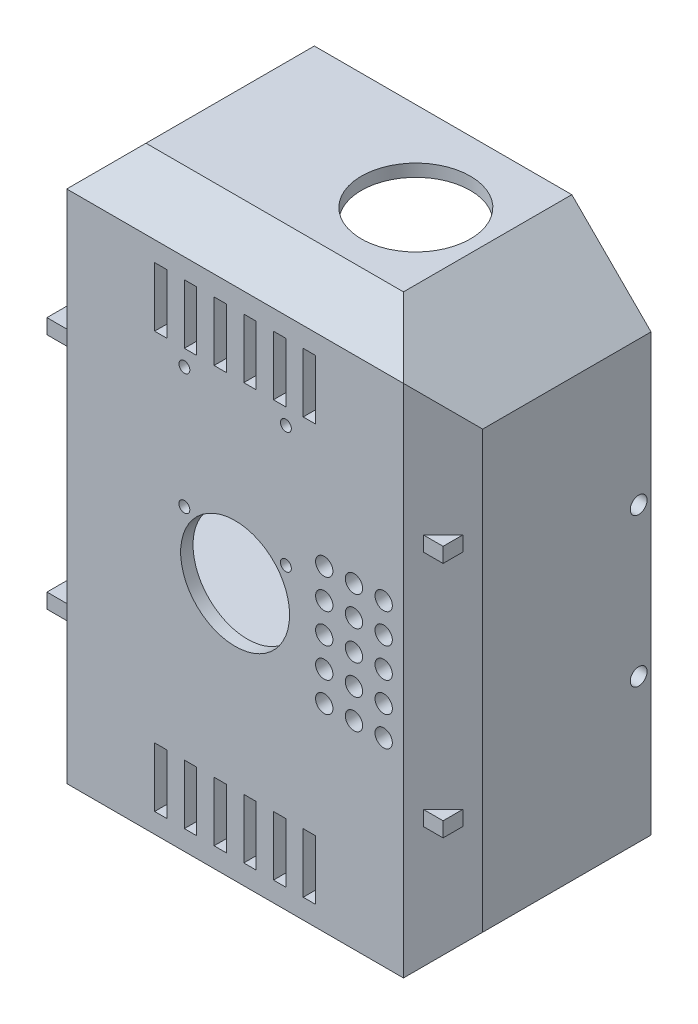
from build123d import *

# Parameters (mm, degrees)
BOSS_1_DEPTH    = 42
CUT_2_DEPTH     = 86
CUT_3_DEPTH     = 86
CUT_4_DEPTH     = 122
CUT_5_DEPTH     = 122
CUT_6_DEPTH     = 31.6
CUT_7_DEPTH     = 4.1
CUT_8_DEPTH     = 4.1
S_HOLE9_R       = 11
HOLE_9_DEPTH    = 2.7
S_CUT10_W       = 2.5
S_CUT10_H       = 12
POCKET_10_DEPTH = 2.7
S_CUT11_W       = 2.5
S_CUT11_H       = 12
POCKET_11_DEPTH = 2.7
S_CUT12_W       = 2.5
S_CUT12_H       = 12
POCKET_12_DEPTH = 2.7
S_CUT13_W       = 2.5
S_CUT13_H       = 12
POCKET_13_DEPTH = 2.7
S_CUT14_W       = 2.5
S_CUT14_H       = 12
POCKET_14_DEPTH = 2.7
S_CUT15_W       = 2.5
S_CUT15_H       = 12
POCKET_15_DEPTH = 2.7
S_HOLE16_R      = 1.7
HOLE_16_DEPTH   = 2.7
S_HOLE17_R      = 1.7
HOLE_17_DEPTH   = 2.7
S_HOLE18_R      = 11
HOLE_18_DEPTH   = 2.7
S_CUT19_W       = 2.5
S_CUT19_H       = 12
POCKET_19_DEPTH = 2.7
S_CUT20_W       = 2.5
S_CUT20_H       = 12
POCKET_20_DEPTH = 2.7
S_CUT21_W       = 2.5
S_CUT21_H       = 12
POCKET_21_DEPTH = 2.7
S_CUT22_W       = 2.5
S_CUT22_H       = 12
POCKET_22_DEPTH = 2.7
S_CUT23_W       = 2.5
S_CUT23_H       = 12
POCKET_23_DEPTH = 2.7
S_CUT24_W       = 2.5
S_CUT24_H       = 12
POCKET_24_DEPTH = 2.7
S_HOLE25_R      = 1.7
HOLE_25_DEPTH   = 2.7
S_HOLE26_R      = 1.7
HOLE_26_DEPTH   = 2.7
S_HOLE27_R      = 1.75
HOLE_27_DEPTH   = 2.7
S_HOLE28_R      = 1.75
HOLE_28_DEPTH   = 2.7
S_HOLE29_R      = 1.75
HOLE_29_DEPTH   = 2.7
S_HOLE30_R      = 1.75
HOLE_30_DEPTH   = 2.7
S_HOLE31_R      = 1.75
HOLE_31_DEPTH   = 2.7
S_HOLE32_R      = 1.75
HOLE_32_DEPTH   = 2.7
S_HOLE33_R      = 1.75
HOLE_33_DEPTH   = 2.7
S_HOLE34_R      = 1.75
HOLE_34_DEPTH   = 2.7
S_HOLE35_R      = 1.75
HOLE_35_DEPTH   = 2.7
S_HOLE36_R      = 1.75
HOLE_36_DEPTH   = 2.7
S_HOLE37_R      = 1.75
HOLE_37_DEPTH   = 2.7
S_HOLE38_R      = 1.75
HOLE_38_DEPTH   = 2.7
S_HOLE39_R      = 1.75
HOLE_39_DEPTH   = 2.7
S_HOLE40_R      = 1.75
HOLE_40_DEPTH   = 2.7
S_HOLE41_R      = 1.75
HOLE_41_DEPTH   = 2.7
S_HOLE42_R      = 11
HOLE_42_DEPTH   = 2.7
S_HOLE43_R      = 1.1
HOLE_43_DEPTH   = 2.7
S_HOLE44_R      = 1.1
HOLE_44_DEPTH   = 2.7
S_HOLE45_R      = 1.1
HOLE_45_DEPTH   = 2.7
S_HOLE46_R      = 1.1
HOLE_46_DEPTH   = 2.7
S_BOX47_W       = 80
S_BOX47_H       = 3
BOSS_47_DEPTH   = 33.5
S_BOX48_W       = 80
S_BOX48_H       = 3
BOSS_48_DEPTH   = 33.5
S_HOLE49_R      = 11
HOLE_49_DEPTH   = 3.2
S_HOLE50_R      = 1.1
HOLE_50_DEPTH   = 3.2
S_HOLE51_R      = 1.1
HOLE_51_DEPTH   = 3.2
S_HOLE52_R      = 1.1
HOLE_52_DEPTH   = 3.2
S_HOLE53_R      = 1.1
HOLE_53_DEPTH   = 3.2
S_HOLE54_R      = 11
HOLE_54_DEPTH   = 3.2
S_HOLE55_R      = 1.1
HOLE_55_DEPTH   = 3.2
S_HOLE56_R      = 1.1
HOLE_56_DEPTH   = 3.2
S_HOLE57_R      = 1.1
HOLE_57_DEPTH   = 3.2
S_HOLE58_R      = 1.1
HOLE_58_DEPTH   = 3.2


with BuildPart() as part:
    # S_prism1 → Boss_1 (new body)
    with BuildSketch(Plane.XY.offset(168)):
        Polygon((42, -44), (42, 44), (26, 60), (-26, 60), (-42, 44), (-42, -44), (-26, -60), (26, -60), align=None)
    extrude(amount=BOSS_1_DEPTH)

    # S_pcut2 → Cut_2 (cut)
    with BuildSketch(Plane(origin=(-43, 0, 0), x_dir=(0, 0, -1), z_dir=(1, 0, 0))):
        Polygon((-210.6, 60.6), (-210.6, 51.4), (-201.4, 60.6), align=None)
    extrude(amount=CUT_2_DEPTH, mode=Mode.SUBTRACT)

    # S_pcut3 → Cut_3 (cut)
    with BuildSketch(Plane(origin=(-43, 0, 0), x_dir=(0, 0, -1), z_dir=(1, 0, 0))):
        Polygon((-210.6, -60.6), (-210.6, -51.4), (-201.4, -60.6), align=None)
    extrude(amount=CUT_3_DEPTH, mode=Mode.SUBTRACT)

    # S_pcut4 → Cut_4 (cut)
    with BuildSketch(Plane(origin=(0, -61, 0), x_dir=(1, 0, 0), z_dir=(0, 1, 0))):
        Polygon((42.6, -210.6), (33.4, -210.6), (42.6, -201.4), align=None)
    extrude(amount=CUT_4_DEPTH, mode=Mode.SUBTRACT)

    # S_pcut5 → Cut_5 (cut)
    with BuildSketch(Plane(origin=(0, -61, 0), x_dir=(1, 0, 0), z_dir=(0, 1, 0))):
        Polygon((-42.6, -210.6), (-33.4, -210.6), (-42.6, -201.4), align=None)
    extrude(amount=CUT_5_DEPTH, mode=Mode.SUBTRACT)

    # S_pcut6 → Cut_6 (cut)
    with BuildSketch(Plane.XY.offset(167.9)):
        Polygon((39.5, -42.964466094), (39.5, 42.964466094), (24.964466094, 57.5), (-24.964466094, 57.5), (-39.5, 42.964466094), (-39.5, -42.964466094), (-24.964466094, -57.5), (24.964466094, -57.5), align=None)
    extrude(amount=CUT_6_DEPTH, mode=Mode.SUBTRACT)

    # S_pcut7 → Cut_7 (cut)
    with BuildSketch(Plane.XY.offset(199.4)):
        Polygon((35.5, -41.307611845), (35.5, 41.307611845), (23.307611845, 53.5), (-23.307611845, 53.5), (-35.5, 41.307611845), (-35.5, -41.307611845), (-23.307611845, -53.5), (23.307611845, -53.5), align=None)
    extrude(amount=CUT_7_DEPTH, mode=Mode.SUBTRACT)

    # S_pcut8 → Cut_8 (cut)
    with BuildSketch(Plane.XY.offset(203.4)):
        Polygon((31.5, -39.650757595), (31.5, 39.650757595), (21.650757595, 49.5), (-21.650757595, 49.5), (-31.5, 39.650757595), (-31.5, -39.650757595), (-21.650757595, -49.5), (21.650757595, -49.5), align=None)
    extrude(amount=CUT_8_DEPTH, mode=Mode.SUBTRACT)

    # S_hole9 → Hole_9 (cut)
    with BuildSketch(Plane(origin=(0, 57.4, 0), x_dir=(1, 0, 0), z_dir=(0, 1, 0))):
        with Locations((12.5, -186)):
            Circle(S_HOLE9_R)
    extrude(amount=HOLE_9_DEPTH, mode=Mode.SUBTRACT)

    # S_cut10 → Pocket_10 (cut)
    with BuildSketch(Plane.XY.offset(207.4)):
        with Locations((-15, 42)):
            Rectangle(S_CUT10_W, S_CUT10_H)
    extrude(amount=POCKET_10_DEPTH, mode=Mode.SUBTRACT)

    # S_cut11 → Pocket_11 (cut)
    with BuildSketch(Plane.XY.offset(207.4)):
        with Locations((-9, 42)):
            Rectangle(S_CUT11_W, S_CUT11_H)
    extrude(amount=POCKET_11_DEPTH, mode=Mode.SUBTRACT)

    # S_cut12 → Pocket_12 (cut)
    with BuildSketch(Plane.XY.offset(207.4)):
        with Locations((-3, 42)):
            Rectangle(S_CUT12_W, S_CUT12_H)
    extrude(amount=POCKET_12_DEPTH, mode=Mode.SUBTRACT)

    # S_cut13 → Pocket_13 (cut)
    with BuildSketch(Plane.XY.offset(207.4)):
        with Locations((3, 42)):
            Rectangle(S_CUT13_W, S_CUT13_H)
    extrude(amount=POCKET_13_DEPTH, mode=Mode.SUBTRACT)

    # S_cut14 → Pocket_14 (cut)
    with BuildSketch(Plane.XY.offset(207.4)):
        with Locations((9, 42)):
            Rectangle(S_CUT14_W, S_CUT14_H)
    extrude(amount=POCKET_14_DEPTH, mode=Mode.SUBTRACT)

    # S_cut15 → Pocket_15 (cut)
    with BuildSketch(Plane.XY.offset(207.4)):
        with Locations((15, 42)):
            Rectangle(S_CUT15_W, S_CUT15_H)
    extrude(amount=POCKET_15_DEPTH, mode=Mode.SUBTRACT)

    # S_hole16 → Hole_16 (cut)
    with BuildSketch(Plane(origin=(39.4, 0, 0), x_dir=(0, 0, -1), z_dir=(1, 0, 0))):
        with Locations((-170.5, -15)):
            Circle(S_HOLE16_R)
    extrude(amount=HOLE_16_DEPTH, mode=Mode.SUBTRACT)

    # S_hole17 → Hole_17 (cut)
    with BuildSketch(Plane(origin=(39.4, 0, 0), x_dir=(0, 0, -1), z_dir=(1, 0, 0))):
        with Locations((-170.5, 15)):
            Circle(S_HOLE17_R)
    extrude(amount=HOLE_17_DEPTH, mode=Mode.SUBTRACT)

    # S_hole18 → Hole_18 (cut)
    with BuildSketch(Plane(origin=(0, -60.1, 0), x_dir=(1, 0, 0), z_dir=(0, 1, 0))):
        with Locations((12.5, -186)):
            Circle(S_HOLE18_R)
    extrude(amount=HOLE_18_DEPTH, mode=Mode.SUBTRACT)

    # S_cut19 → Pocket_19 (cut)
    with BuildSketch(Plane.XY.offset(207.4)):
        with Locations((-15, -42)):
            Rectangle(S_CUT19_W, S_CUT19_H)
    extrude(amount=POCKET_19_DEPTH, mode=Mode.SUBTRACT)

    # S_cut20 → Pocket_20 (cut)
    with BuildSketch(Plane.XY.offset(207.4)):
        with Locations((-9, -42)):
            Rectangle(S_CUT20_W, S_CUT20_H)
    extrude(amount=POCKET_20_DEPTH, mode=Mode.SUBTRACT)

    # S_cut21 → Pocket_21 (cut)
    with BuildSketch(Plane.XY.offset(207.4)):
        with Locations((-3, -42)):
            Rectangle(S_CUT21_W, S_CUT21_H)
    extrude(amount=POCKET_21_DEPTH, mode=Mode.SUBTRACT)

    # S_cut22 → Pocket_22 (cut)
    with BuildSketch(Plane.XY.offset(207.4)):
        with Locations((3, -42)):
            Rectangle(S_CUT22_W, S_CUT22_H)
    extrude(amount=POCKET_22_DEPTH, mode=Mode.SUBTRACT)

    # S_cut23 → Pocket_23 (cut)
    with BuildSketch(Plane.XY.offset(207.4)):
        with Locations((9, -42)):
            Rectangle(S_CUT23_W, S_CUT23_H)
    extrude(amount=POCKET_23_DEPTH, mode=Mode.SUBTRACT)

    # S_cut24 → Pocket_24 (cut)
    with BuildSketch(Plane.XY.offset(207.4)):
        with Locations((15, -42)):
            Rectangle(S_CUT24_W, S_CUT24_H)
    extrude(amount=POCKET_24_DEPTH, mode=Mode.SUBTRACT)

    # S_hole25 → Hole_25 (cut)
    with BuildSketch(Plane(origin=(-42.1, 0, 0), x_dir=(0, 0, -1), z_dir=(1, 0, 0))):
        with Locations((-170.5, -15)):
            Circle(S_HOLE25_R)
    extrude(amount=HOLE_25_DEPTH, mode=Mode.SUBTRACT)

    # S_hole26 → Hole_26 (cut)
    with BuildSketch(Plane(origin=(-42.1, 0, 0), x_dir=(0, 0, -1), z_dir=(1, 0, 0))):
        with Locations((-170.5, 15)):
            Circle(S_HOLE26_R)
    extrude(amount=HOLE_26_DEPTH, mode=Mode.SUBTRACT)

    # S_hole27 → Hole_27 (cut)
    with BuildSketch(Plane.XY.offset(207.4)):
        with Locations((18, -12)):
            Circle(S_HOLE27_R)
    extrude(amount=HOLE_27_DEPTH, mode=Mode.SUBTRACT)

    # S_hole28 → Hole_28 (cut)
    with BuildSketch(Plane.XY.offset(207.4)):
        with Locations((18, -6)):
            Circle(S_HOLE28_R)
    extrude(amount=HOLE_28_DEPTH, mode=Mode.SUBTRACT)

    # S_hole29 → Hole_29 (cut)
    with BuildSketch(Plane.XY.offset(207.4)):
        with Locations((18, 0)):
            Circle(S_HOLE29_R)
    extrude(amount=HOLE_29_DEPTH, mode=Mode.SUBTRACT)

    # S_hole30 → Hole_30 (cut)
    with BuildSketch(Plane.XY.offset(207.4)):
        with Locations((18, 6)):
            Circle(S_HOLE30_R)
    extrude(amount=HOLE_30_DEPTH, mode=Mode.SUBTRACT)

    # S_hole31 → Hole_31 (cut)
    with BuildSketch(Plane.XY.offset(207.4)):
        with Locations((18, 12)):
            Circle(S_HOLE31_R)
    extrude(amount=HOLE_31_DEPTH, mode=Mode.SUBTRACT)

    # S_hole32 → Hole_32 (cut)
    with BuildSketch(Plane.XY.offset(207.4)):
        with Locations((24, -12)):
            Circle(S_HOLE32_R)
    extrude(amount=HOLE_32_DEPTH, mode=Mode.SUBTRACT)

    # S_hole33 → Hole_33 (cut)
    with BuildSketch(Plane.XY.offset(207.4)):
        with Locations((24, -6)):
            Circle(S_HOLE33_R)
    extrude(amount=HOLE_33_DEPTH, mode=Mode.SUBTRACT)

    # S_hole34 → Hole_34 (cut)
    with BuildSketch(Plane.XY.offset(207.4)):
        with Locations((24, 0)):
            Circle(S_HOLE34_R)
    extrude(amount=HOLE_34_DEPTH, mode=Mode.SUBTRACT)

    # S_hole35 → Hole_35 (cut)
    with BuildSketch(Plane.XY.offset(207.4)):
        with Locations((24, 6)):
            Circle(S_HOLE35_R)
    extrude(amount=HOLE_35_DEPTH, mode=Mode.SUBTRACT)

    # S_hole36 → Hole_36 (cut)
    with BuildSketch(Plane.XY.offset(207.4)):
        with Locations((24, 12)):
            Circle(S_HOLE36_R)
    extrude(amount=HOLE_36_DEPTH, mode=Mode.SUBTRACT)

    # S_hole37 → Hole_37 (cut)
    with BuildSketch(Plane.XY.offset(207.4)):
        with Locations((30, -12)):
            Circle(S_HOLE37_R)
    extrude(amount=HOLE_37_DEPTH, mode=Mode.SUBTRACT)

    # S_hole38 → Hole_38 (cut)
    with BuildSketch(Plane.XY.offset(207.4)):
        with Locations((30, -6)):
            Circle(S_HOLE38_R)
    extrude(amount=HOLE_38_DEPTH, mode=Mode.SUBTRACT)

    # S_hole39 → Hole_39 (cut)
    with BuildSketch(Plane.XY.offset(207.4)):
        with Locations((30, 0)):
            Circle(S_HOLE39_R)
    extrude(amount=HOLE_39_DEPTH, mode=Mode.SUBTRACT)

    # S_hole40 → Hole_40 (cut)
    with BuildSketch(Plane.XY.offset(207.4)):
        with Locations((30, 6)):
            Circle(S_HOLE40_R)
    extrude(amount=HOLE_40_DEPTH, mode=Mode.SUBTRACT)

    # S_hole41 → Hole_41 (cut)
    with BuildSketch(Plane.XY.offset(207.4)):
        with Locations((30, 12)):
            Circle(S_HOLE41_R)
    extrude(amount=HOLE_41_DEPTH, mode=Mode.SUBTRACT)

    # S_hole42 → Hole_42 (cut)
    with BuildSketch(Plane.XY.offset(207.4)):
        Circle(S_HOLE42_R)
    extrude(amount=HOLE_42_DEPTH, mode=Mode.SUBTRACT)

    # S_hole43 → Hole_43 (cut)
    with BuildSketch(Plane.XY.offset(207.4)):
        with Locations((-10.25, 8.3)):
            Circle(S_HOLE43_R)
    extrude(amount=HOLE_43_DEPTH, mode=Mode.SUBTRACT)

    # S_hole44 → Hole_44 (cut)
    with BuildSketch(Plane.XY.offset(207.4)):
        with Locations((10.25, 8.3)):
            Circle(S_HOLE44_R)
    extrude(amount=HOLE_44_DEPTH, mode=Mode.SUBTRACT)

    # S_hole45 → Hole_45 (cut)
    with BuildSketch(Plane.XY.offset(207.4)):
        with Locations((-10.25, 32.75)):
            Circle(S_HOLE45_R)
    extrude(amount=HOLE_45_DEPTH, mode=Mode.SUBTRACT)

    # S_hole46 → Hole_46 (cut)
    with BuildSketch(Plane.XY.offset(207.4)):
        with Locations((10.25, 32.75)):
            Circle(S_HOLE46_R)
    extrude(amount=HOLE_46_DEPTH, mode=Mode.SUBTRACT)

    # S_box47 → Boss_47 (add)
    with BuildSketch(Plane.XY.offset(174.5)):
        with Locations((0, 24)):
            Rectangle(S_BOX47_W, S_BOX47_H)
    extrude(amount=BOSS_47_DEPTH)

    # S_box48 → Boss_48 (add)
    with BuildSketch(Plane.XY.offset(174.5)):
        with Locations((0, -24)):
            Rectangle(S_BOX48_W, S_BOX48_H)
    extrude(amount=BOSS_48_DEPTH)

    # S_hole49 → Hole_49 (cut)
    with BuildSketch(Plane(origin=(0, 22.4, 0), x_dir=(1, 0, 0), z_dir=(0, 1, 0))):
        with Locations((12.5, -186)):
            Circle(S_HOLE49_R)
    extrude(amount=HOLE_49_DEPTH, mode=Mode.SUBTRACT)

    # S_hole50 → Hole_50 (cut)
    with BuildSketch(Plane(origin=(0, 22.4, 0), x_dir=(1, 0, 0), z_dir=(0, 1, 0))):
        with Locations((4.2, -175.75)):
            Circle(S_HOLE50_R)
    extrude(amount=HOLE_50_DEPTH, mode=Mode.SUBTRACT)

    # S_hole51 → Hole_51 (cut)
    with BuildSketch(Plane(origin=(0, 22.4, 0), x_dir=(1, 0, 0), z_dir=(0, 1, 0))):
        with Locations((4.2, -196.25)):
            Circle(S_HOLE51_R)
    extrude(amount=HOLE_51_DEPTH, mode=Mode.SUBTRACT)

    # S_hole52 → Hole_52 (cut)
    with BuildSketch(Plane(origin=(0, 22.4, 0), x_dir=(1, 0, 0), z_dir=(0, 1, 0))):
        with Locations((-20.25, -175.75)):
            Circle(S_HOLE52_R)
    extrude(amount=HOLE_52_DEPTH, mode=Mode.SUBTRACT)

    # S_hole53 → Hole_53 (cut)
    with BuildSketch(Plane(origin=(0, 22.4, 0), x_dir=(1, 0, 0), z_dir=(0, 1, 0))):
        with Locations((-20.25, -196.25)):
            Circle(S_HOLE53_R)
    extrude(amount=HOLE_53_DEPTH, mode=Mode.SUBTRACT)

    # S_hole54 → Hole_54 (cut)
    with BuildSketch(Plane(origin=(0, -25.6, 0), x_dir=(1, 0, 0), z_dir=(0, 1, 0))):
        with Locations((12.5, -186)):
            Circle(S_HOLE54_R)
    extrude(amount=HOLE_54_DEPTH, mode=Mode.SUBTRACT)

    # S_hole55 → Hole_55 (cut)
    with BuildSketch(Plane(origin=(0, -25.6, 0), x_dir=(1, 0, 0), z_dir=(0, 1, 0))):
        with Locations((4.2, -175.75)):
            Circle(S_HOLE55_R)
    extrude(amount=HOLE_55_DEPTH, mode=Mode.SUBTRACT)

    # S_hole56 → Hole_56 (cut)
    with BuildSketch(Plane(origin=(0, -25.6, 0), x_dir=(1, 0, 0), z_dir=(0, 1, 0))):
        with Locations((4.2, -196.25)):
            Circle(S_HOLE56_R)
    extrude(amount=HOLE_56_DEPTH, mode=Mode.SUBTRACT)

    # S_hole57 → Hole_57 (cut)
    with BuildSketch(Plane(origin=(0, -25.6, 0), x_dir=(1, 0, 0), z_dir=(0, 1, 0))):
        with Locations((-20.25, -175.75)):
            Circle(S_HOLE57_R)
    extrude(amount=HOLE_57_DEPTH, mode=Mode.SUBTRACT)

    # S_hole58 → Hole_58 (cut)
    with BuildSketch(Plane(origin=(0, -25.6, 0), x_dir=(1, 0, 0), z_dir=(0, 1, 0))):
        with Locations((-20.25, -196.25)):
            Circle(S_HOLE58_R)
    extrude(amount=HOLE_58_DEPTH, mode=Mode.SUBTRACT)


solid = part.part
